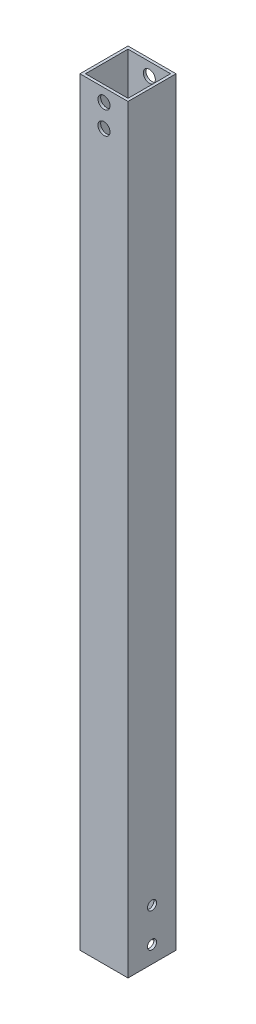
from build123d import *

# Parameters (mm, degrees)
SKETCH1_W               = 26.924
SKETCH1_H               = 26.924
SKETCH1_W_2             = 23.876
SKETCH1_H_2             = 23.876
EXTRUDE_THIN1_DEPTH     = 425.45
F_1_4_CLEARANCE_HOLE1_D = 6.7564
F_10_CLEARANCE_HOLE1_D  = 5.1054


with BuildPart() as part:
    # Sketch1 → Extrude-Thin1 (new body)
    with BuildSketch(Plane(origin=(0, 0, 0), x_dir=(1, 0, 0), z_dir=(0, 1, 0))):
        Rectangle(SKETCH1_W, SKETCH1_H)
        Rectangle(SKETCH1_W_2, SKETCH1_H_2, mode=Mode.SUBTRACT)
    extrude(amount=EXTRUDE_THIN1_DEPTH)

    # 1/4 Clearance Hole1 (through all)
    with Locations(Plane(origin=(0, 0, -13.462), x_dir=(-1, 0, 0), z_dir=(0, 0, -1))):
        with Locations((0, 418.2745), (0, 405.5745)):
            Hole(F_1_4_CLEARANCE_HOLE1_D / 2)

    # #10 Clearance Hole1 (through all)
    with Locations(Plane(origin=(13.462, 0, 0), x_dir=(0, 0, -1), z_dir=(1, 0, 0))):
        with Locations((0, 9.525), (0, 28.575)):
            Hole(F_10_CLEARANCE_HOLE1_D / 2)


solid = part.part
